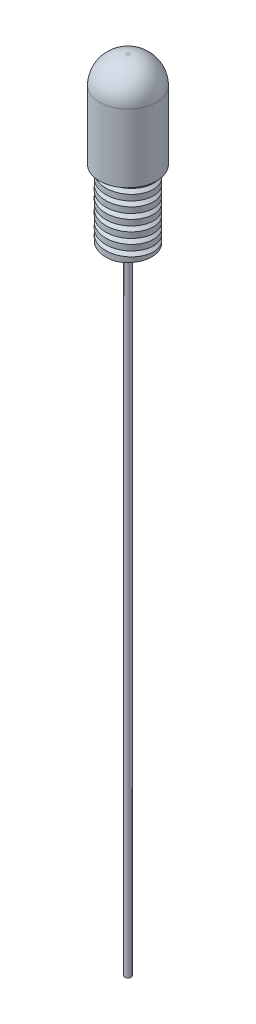
from build123d import *

# Parameters (mm, degrees)
SKETCH1_R           = 1.75
BOSS_EXTRUDE1_DEPTH = 8
CUT_SWEEP1_PITCH    = 0.794
BOSS_EXTRUDE2_START = -10
SKETCH6_R           = 0.2318
SKETCH6_R_2         = 0.13
BOSS_EXTRUDE2_DEPTH = 56.5
BOSS_EXTRUDE3_START = 2
SKETCH8_R           = 2.101757455
SKETCH8_R_2         = 1.83825782
BOSS_EXTRUDE3_DEPTH = 5
SKETCH9_R           = 2.101757455
BOSS_EXTRUDE4_DEPTH = 2


with BuildPart() as part:
    # Sketch1 → Boss-Extrude1 (new body)
    with BuildSketch(Plane(origin=(0, 0, 0), x_dir=(1, 0, 0), z_dir=(0, 1, 0))):
        with Locations(Location((0, 0, 0), (0, 0, 270))):
            Circle(SKETCH1_R)
    extrude(amount=-BOSS_EXTRUDE1_DEPTH)

    # Cut-Sweep1: arcs per turn and ends read off the stored shape
    # Cut-Sweep1: the profile of Sketch5 screwed along a left-hand helix through 12 turns, 8 arcs to a turn; built about Z, then put on its axis
    cut_sweep1_z = Axis((0, 0, 0), (0, 0, 1))
    cut_sweep1_corners = [(1.425, 0, -0.794), (1.9125, 0, -1.075458256), (1.9125, 0, -0.512541744)]
    with BuildLine(mode=Mode.PRIVATE) as cut_sweep1_profile:
        Line(cut_sweep1_corners[0], cut_sweep1_corners[1])
        Line(cut_sweep1_corners[1], cut_sweep1_corners[2])
        Line(cut_sweep1_corners[2], cut_sweep1_corners[0])
    cut_sweep1_cap = Face(cut_sweep1_profile.wire())
    cut_sweep1_turn_angles = [0, -22.5, -45, -67.5, -90, -112.5, -135, -157.5, -180, -202.5, -225, -247.5, -270, -292.5, -315, -337.5, -360]
    cut_sweep1_turn_weights = [1, 0.9238795325112867, 1, 0.9238795325112867, 1, 0.9238795325112867, 1, 0.9238795325112867, 1, 0.9238795325112867, 1, 0.9238795325112867, 1, 0.9238795325112867, 1, 0.9238795325112867, 1]
    cut_sweep1_turn_rails = [Edge.make_bspline([Vector(p[0], p[1], 0).rotate(cut_sweep1_z, cut_sweep1_turn_angles[k]) / cut_sweep1_turn_weights[k] + Vector(0, 0, p[2] + -CUT_SWEEP1_PITCH * cut_sweep1_turn_angles[k] / 360) for k in range(17)], [0, 0, 0, 1, 1, 2, 2, 3, 3, 4, 4, 5, 5, 6, 6, 7, 7, 8, 8, 8], 2, cut_sweep1_turn_weights) for p in cut_sweep1_corners]
    cut_sweep1_turn_sides = [Face.make_surface_from_curves(cut_sweep1_turn_rails[p[0]], cut_sweep1_turn_rails[p[1]]) for p in [(0, 1), (1, 2), (2, 0)]]
    cut_sweep1 = Plane(origin=(0, 0, 0), x_dir=(-1, 0, 0), z_dir=(0, -1, 0)) * Solid(Shell([*[p.moved(Location((0, 0, CUT_SWEEP1_PITCH * i))) for i in range(12) for p in cut_sweep1_turn_sides], cut_sweep1_cap, cut_sweep1_cap.rotate(cut_sweep1_z, -4320).moved(Location((0, 0, -CUT_SWEEP1_PITCH * -4320 / 360)))]))
    add(cut_sweep1, mode=Mode.SUBTRACT)


with BuildPart() as body_2:
    # Sketch6 → Boss-Extrude2 (new body)
    with BuildSketch(Plane(origin=(0, -8, 0), x_dir=(-1, 0, 0), z_dir=(0, -1, 0)).offset(BOSS_EXTRUDE2_START)):
        with Locations(Location((0, 0, 0), (0, 0, 90))):
            Circle(SKETCH6_R)
        with Locations(Location((0, 0, 0), (0, 0, 90))):
            Circle(SKETCH6_R_2, mode=Mode.SUBTRACT)
    extrude(amount=BOSS_EXTRUDE2_DEPTH)


with BuildPart() as body_3:
    # Sketch8 → Boss-Extrude3 (new body)
    with BuildSketch(Plane(origin=(0, 0, 0), x_dir=(1, 0, 0), z_dir=(0, 1, 0)).offset(BOSS_EXTRUDE3_START)):
        with Locations(Location((0, 0, 0), (0, 0, 270))):
            Circle(SKETCH8_R)
        with Locations(Location((0, 0, 0), (0, 0, 270))):
            Circle(SKETCH8_R_2, mode=Mode.SUBTRACT)
    extrude(amount=-BOSS_EXTRUDE3_DEPTH)

    # Sketch9 → Boss-Extrude4 (add)
    with BuildSketch(Plane(origin=(0, 2, 0), x_dir=(1, 0, 0), z_dir=(0, 1, 0))):
        with Locations(Location((0, 0, 0), (0, 0, 270))):
            Circle(SKETCH9_R)
    extrude(amount=BOSS_EXTRUDE4_DEPTH)

    # Fillet4: read off the stored shape, not the designer's step
    # Fillet4 outline → Fillet4 (revolve, cut)
    with BuildSketch(Plane.XY):
        with BuildLine():
            ThreePointArc((0.101757455, 4), (1.515971017, 3.414213563), (2.101757455, 2))
            Line((2.101757455, 2), (2.101757455, 4))
            Line((2.101757455, 4), (0.101757455, 4))
        make_face()
    revolve(axis=Axis((0, 0, 0), (0, 1, 0)), mode=Mode.SUBTRACT)


solid = Compound([part.part, body_2.part, body_3.part])
